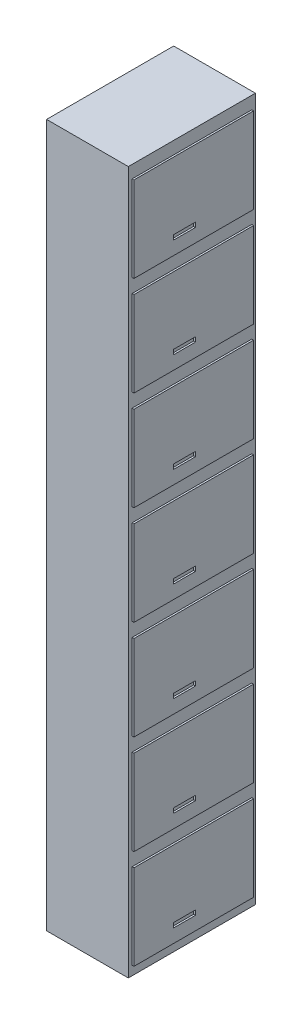
from build123d import *

# Parameters (mm, degrees)
SKETCH1_W           = 450
SKETCH1_H           = 3870
BOSS_EXTRUDE1_DEPTH = 700
SKETCH3_W           = 658.862952103
SKETCH3_H           = 470
SKETCH3_W_2         = 121.072841775
SKETCH3_H_2         = 25.802408902
SKETCH3_H_3         = 25.802408903
BOSS_EXTRUDE3_DEPTH = 10


with BuildPart() as part:
    # Sketch1 → Boss-Extrude1 (new body)
    with BuildSketch(Plane.XY):
        with Locations((88.061970043, 2244.986327315)):
            Rectangle(SKETCH1_W, SKETCH1_H)
    extrude(amount=BOSS_EXTRUDE1_DEPTH)

    # Sketch3 → Boss-Extrude3 (add)
    # profile 1 of 7: a face of its own
    with BuildSketch(Plane(origin=(313.061970043, 0, 0), x_dir=(0, 0, -1), z_dir=(1, 0, 0))):
        with Locations((-349.431476051, 594.986327315)):
            Rectangle(SKETCH3_W, SKETCH3_H)
        with Locations((-401.128332344, 446.85045415)):
            Rectangle(SKETCH3_W_2, SKETCH3_H_2, mode=Mode.SUBTRACT)
    # profile 2 of 7: a face of its own
    with BuildSketch(Plane(origin=(313.061970043, 0, 0), x_dir=(0, 0, -1), z_dir=(1, 0, 0))):
        with Locations((-349.431476051, 1141.758813467)):
            Rectangle(SKETCH3_W, SKETCH3_H)
        with Locations((-401.128332344, 993.622940303)):
            Rectangle(SKETCH3_W_2, SKETCH3_H_3, mode=Mode.SUBTRACT)
    # profile 3 of 7: a face of its own
    with BuildSketch(Plane(origin=(313.061970043, 0, 0), x_dir=(0, 0, -1), z_dir=(1, 0, 0))):
        with Locations((-349.431476051, 1688.531299619)):
            Rectangle(SKETCH3_W, SKETCH3_H)
        with Locations((-401.128332344, 1540.395426455)):
            Rectangle(SKETCH3_W_2, SKETCH3_H_3, mode=Mode.SUBTRACT)
    # profile 4 of 7: a face of its own
    with BuildSketch(Plane(origin=(313.061970043, 0, 0), x_dir=(0, 0, -1), z_dir=(1, 0, 0))):
        with Locations((-349.431476051, 2235.303785772)):
            Rectangle(SKETCH3_W, SKETCH3_H)
        with Locations((-401.128332344, 2087.167912607)):
            Rectangle(SKETCH3_W_2, SKETCH3_H_3, mode=Mode.SUBTRACT)
    # profile 5 of 7: a face of its own
    with BuildSketch(Plane(origin=(313.061970043, 0, 0), x_dir=(0, 0, -1), z_dir=(1, 0, 0))):
        with Locations((-349.431476051, 2782.076271924)):
            Rectangle(SKETCH3_W, SKETCH3_H)
        with Locations((-401.128332344, 2633.940398759)):
            Rectangle(SKETCH3_W_2, SKETCH3_H_3, mode=Mode.SUBTRACT)
    # profile 6 of 7: a face of its own
    with BuildSketch(Plane(origin=(313.061970043, 0, 0), x_dir=(0, 0, -1), z_dir=(1, 0, 0))):
        with Locations((-349.431476051, 3328.848758076)):
            Rectangle(SKETCH3_W, SKETCH3_H)
        with Locations((-401.128332344, 3180.712884911)):
            Rectangle(SKETCH3_W_2, SKETCH3_H_2, mode=Mode.SUBTRACT)
    # profile 7 of 7: a face of its own
    with BuildSketch(Plane(origin=(313.061970043, 0, 0), x_dir=(0, 0, -1), z_dir=(1, 0, 0))):
        with Locations((-349.431476051, 3875.621244228)):
            Rectangle(SKETCH3_W, SKETCH3_H)
        with Locations((-401.128332344, 3727.485371064)):
            Rectangle(SKETCH3_W_2, SKETCH3_H_3, mode=Mode.SUBTRACT)
    extrude(amount=BOSS_EXTRUDE3_DEPTH)


solid = part.part
